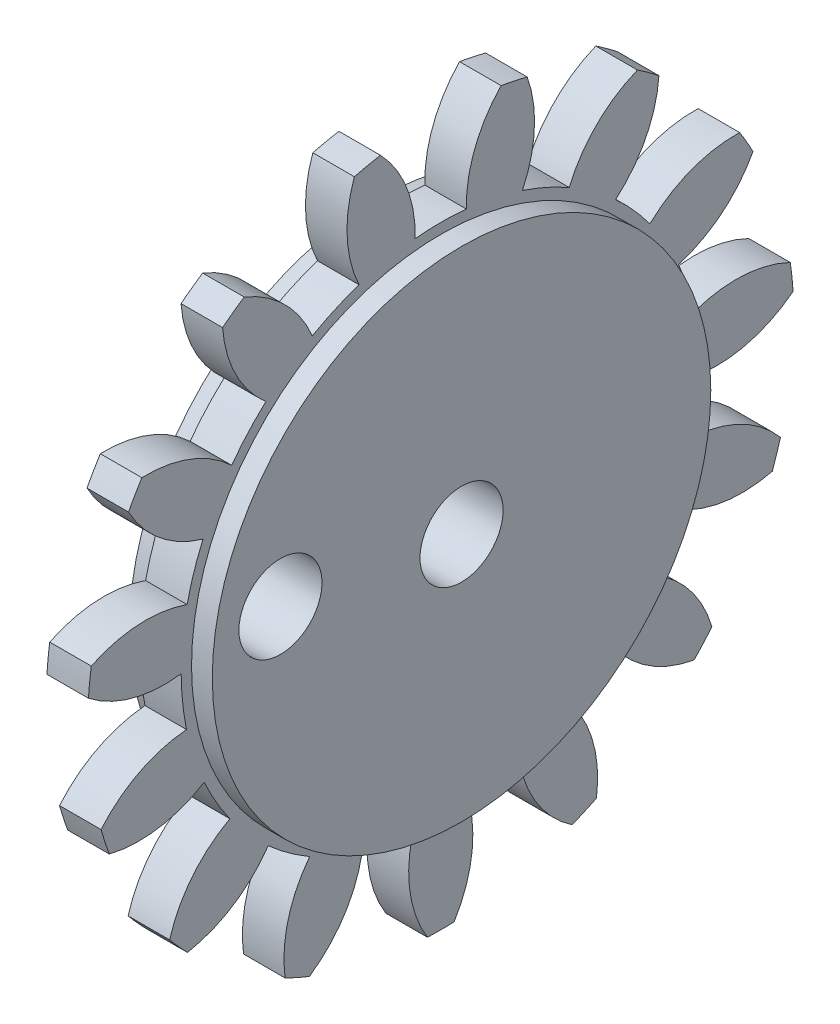
from build123d import *

# Parameters (mm, degrees)
BASPROSKE_W        = 6.35
BASPROSKE_H        = 53.975
TOOTHCUT_DEPTH     = 77.59584682
TEETHCUTS_COUNT    = 15
TEETHCUTS_ANGLE    = 336
HUBNEABOTSKE_R     = 38.1
HUBNEARBOTH_DEPTH  = 3.1750254
HUBFAR_START       = 3.1750254
HUBFARSKE_R        = 38.1
HUBFAR_DEPTH       = 3.1750254
BORSKE_R           = 6.35
BORE_DEPTH         = 12.7000508
SKETCH1_R          = 6.35
CUT_EXTRUDE1_DEPTH = 78.297193623
SCALE1_SCALE       = 0.75


with BuildPart() as part:
    # BasProSke → Base-Revolve (revolve)
    with BuildSketch(Plane(origin=(0, 0, 0), x_dir=(1, 0, 0), z_dir=(0, 1, 0))):
        with Locations((3.175, 26.9875)):
            Rectangle(BASPROSKE_W, BASPROSKE_H)
    revolve(axis=Axis((-10, 0, 0), (1, 0, 0)))

    # TooCutSke → ToothCut (cut, through all)
    with BuildSketch(Plane(origin=(0, 0, 0), x_dir=(0, 0, -1), z_dir=(1, 0, 0))):
        with BuildLine():
            ThreePointArc((3.91547882, 39.492605349), (0, 39.68623), (-3.91547882, 39.492605349))
            ThreePointArc((-3.91547882, 39.492605349), (-5.201686692, 46.882953453), (-9.241355572, 53.20376441))
            ThreePointArc((-9.241355572, 53.20376441), (0, 54.0004), (9.241355572, 53.20376441))
            ThreePointArc((9.241355572, 53.20376441), (5.201686692, 46.882953453), (3.91547882, 39.492605349))
        make_face()
    toothcut = extrude(amount=TOOTHCUT_DEPTH, mode=Mode.SUBTRACT)

    # TeethCuts: ToothCut ×15 about axis
    teethcuts_axis = Axis((-10, 0, 0), (1, 0, 0))
    for i in range(1, TEETHCUTS_COUNT):
        add(toothcut.rotate(teethcuts_axis, i * TEETHCUTS_ANGLE / (TEETHCUTS_COUNT - 1)), mode=Mode.SUBTRACT)

    # HubNeaBotSke → HubNearBoth (add)
    with BuildSketch(Plane.ZY):
        Circle(HUBNEABOTSKE_R)
    extrude(amount=HUBNEARBOTH_DEPTH)

    # HubFarSke → HubFar (add)
    with BuildSketch(Plane(origin=(6.35, 0, 0), x_dir=(0, 0, -1), z_dir=(1, 0, 0)).offset(HUBFAR_START)):
        Circle(HUBFARSKE_R)
    extrude(amount=-HUBFAR_DEPTH)

    # BorSke → Bore (cut, symmetric)
    with BuildSketch(Plane(origin=(0, 0, 0), x_dir=(0, 0, -1), z_dir=(1, 0, 0))):
        Circle(BORSKE_R)
    extrude(amount=BORE_DEPTH, both=True, mode=Mode.SUBTRACT)

    # Sketch1 → Cut-Extrude1 (cut, through all)
    with BuildSketch(Plane.ZY.offset(3.1750254)):
        with Locations((27.682550617, 4.269063845)):
            Circle(SKETCH1_R)
    extrude(amount=-CUT_EXTRUDE1_DEPTH, mode=Mode.SUBTRACT)


with BuildPart() as part_1:
    # Scale1: scaled about (3.175, -0.100027295, -0.648622452)
    add(part.part.scale(SCALE1_SCALE).moved(Location((0.79375, -0.025006824, -0.162155613))))


solid = part_1.part
